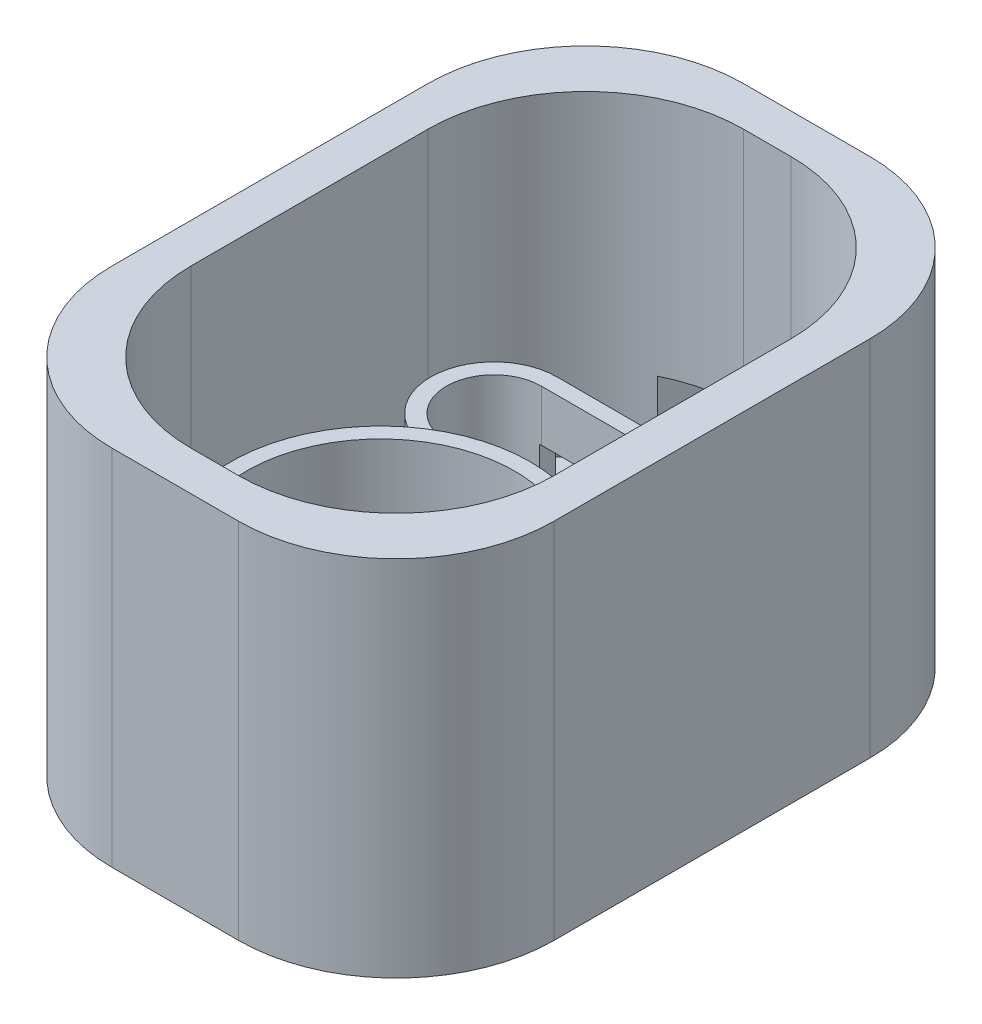
from build123d import *

# Parameters (mm, degrees)
SKETCH1_W               = 28
SKETCH1_H               = 40
SKETCH1_W_2             = 23
SKETCH1_H_2             = 35
BOSS_EXTRUDE4_DEPTH     = 10
SKETCH1_R               = 9.5
SKETCH1_R_2             = 8.5
BOSS_EXTRUDE4_2_DEPTH   = 10
SKETCH1_5_W             = 28
SKETCH1_5_H             = 40
SKETCH1_5_W_2           = 23
SKETCH1_5_H_2           = 35
BOSS_EXTRUDE5_DEPTH     = 20
SKETCH3_W               = 28
SKETCH3_H               = 40
BOSS_EXTRUDE6_DEPTH     = 3
BOSS_EXTRUDE9_DEPTH     = 8
CUT_EXTRUDE2_DEPTH      = 11
CUT_EXTRUDE2_DEPTH_BACK = 8
SKETCH6_W               = 3.5
SKETCH6_H               = 3.5
FILLET1_R               = 10


with BuildPart() as part:
    # Sketch1 → Boss-Extrude4 (new body)
    with BuildSketch(Plane(origin=(0, 0, 0), x_dir=(1, 0, 0), z_dir=(0, 1, 0))):
        with Locations((0, 7)):
            Rectangle(SKETCH1_W, SKETCH1_H)
        with Locations((0, 7)):
            Rectangle(SKETCH1_W_2, SKETCH1_H_2, mode=Mode.SUBTRACT)
    extrude(amount=BOSS_EXTRUDE4_DEPTH)

    # Sketch1<5> → Boss-Extrude5 (add)
    with BuildSketch(Plane(origin=(0, 0, 0), x_dir=(1, 0, 0), z_dir=(0, 1, 0))):
        with Locations((0, 7)):
            Rectangle(SKETCH1_5_W, SKETCH1_5_H)
        with Locations((0, 7)):
            Rectangle(SKETCH1_5_W_2, SKETCH1_5_H_2, mode=Mode.SUBTRACT)
    extrude(amount=BOSS_EXTRUDE5_DEPTH)



with BuildPart() as body_2:
    # Sketch1 → Boss-Extrude4 2 (new body)
    with BuildSketch(Plane(origin=(0, 0, 0), x_dir=(1, 0, 0), z_dir=(0, 1, 0))):
        with Locations(Location((0, 0, 0), (0, 0, 270))):
            Circle(SKETCH1_R)
        with Locations(Location((0, 0, 0), (0, 0, 270))):
            Circle(SKETCH1_R_2, mode=Mode.SUBTRACT)
    extrude(amount=BOSS_EXTRUDE4_2_DEPTH)


with BuildPart() as part_1:
    add(part.part)

    add(body_2.part)  # Boss-Extrude6 merges body 2
    # Sketch3 → Boss-Extrude6 (add)
    with BuildSketch(Plane.XZ):
        with Locations((0, -7)):
            Rectangle(SKETCH3_W, SKETCH3_H)
    extrude(amount=BOSS_EXTRUDE6_DEPTH)


with BuildPart() as body_2_2:
    # Sketch4 → Boss-Extrude9 (new body)
    with BuildSketch(Plane(origin=(0, 0, 0), x_dir=(1, 0, 0), z_dir=(0, 1, 0))):
        with BuildLine():
            Line((-5.815986723, 17), (5.576152219, 17))
            ThreePointArc((5.576152219, 17), (9.576152219, 13), (5.576152219, 9))
            Line((5.576152219, 9), (-5.815986723, 9))
            ThreePointArc((-5.815986723, 9), (-9.815986723, 13), (-5.815986723, 17))
        make_face()
        with BuildLine():
            Line((-5.815986723, 16), (5.576152219, 16))
            ThreePointArc((5.576152219, 16), (8.576152219, 13), (5.576152219, 10))
            Line((5.576152219, 10), (-5.815986723, 10))
            ThreePointArc((-5.815986723, 10), (-8.815986723, 13), (-5.815986723, 16))
        make_face(mode=Mode.SUBTRACT)
    extrude(amount=BOSS_EXTRUDE9_DEPTH)


with BuildPart() as cut_extrude2_tool:
    # Sketch6 → Cut-Extrude2 (new, two sides: drawn at the far end of the back side and taken through both)
    with BuildSketch(Plane.XY.offset(-24.5).offset(-CUT_EXTRUDE2_DEPTH_BACK)):
        with Locations((3.826152219, 3.007864186)):
            Rectangle(SKETCH6_W, SKETCH6_H)
        with Locations((-0.173847781, 3.007864186)):
            Rectangle(SKETCH6_W, SKETCH6_H)
        with Locations((-4.173847781, 3.007864186)):
            Rectangle(SKETCH6_W, SKETCH6_H)
    extrude(amount=CUT_EXTRUDE2_DEPTH + CUT_EXTRUDE2_DEPTH_BACK)


with BuildPart() as part_2:
    add(part_1.part)

    # Cut-Extrude2: cut by cut_extrude2_tool
    add(cut_extrude2_tool.part, mode=Mode.SUBTRACT)

    # Fillet1
    # the kernel refuses this fillet: 10 mm, written as the material it adds along each edge
    with BuildSketch(Plane(origin=(-11.5, 20, 10.5), x_dir=(0, 0, -1), z_dir=(0, -1, 0)), Plane(origin=(11.5, 20, 10.5), x_dir=(-1, 0, 0), z_dir=(0, -1, 0))) as fillet1_piece_1:
        with BuildLine():
            CenterArc((FILLET1_R, FILLET1_R), FILLET1_R, 180, 90)
            Line((0, FILLET1_R), (0, 0))
            Line((0, 0), (FILLET1_R, 0))
        make_face()
    extrude(amount=20)
    with BuildSketch(Plane(origin=(11.5, 20, -24.5), x_dir=(0, 0, 1), z_dir=(0, -1, 0))) as fillet1_piece_2_section:
        with BuildLine():
            CenterArc((FILLET1_R, FILLET1_R), FILLET1_R, 180, 90)
            Line((0, FILLET1_R), (0, 0))
            Line((0, 0), (FILLET1_R, 0))
        make_face()
    fillet1_piece_2 = extrude(amount=45, mode=Mode.PRIVATE)
    fillet1_piece_2 = split(fillet1_piece_2, bisect_by=Plane(origin=(9.534581137, 4.757864186, -22.153586086), z_dir=(0, 1, 0)), keep=Keep.TOP, mode=Mode.PRIVATE)
    add(fillet1_piece_2)
    with BuildSketch(Plane(origin=(11.5, 45, -24.5), x_dir=(0, 0, 1), z_dir=(0, -1, 0))) as fillet1_piece_3_section:
        with BuildLine():
            CenterArc((FILLET1_R, FILLET1_R), FILLET1_R, 180, 90)
            Line((0, FILLET1_R), (0, 0))
            Line((0, 0), (FILLET1_R, 0))
        make_face()
    fillet1_piece_3 = extrude(amount=45, mode=Mode.PRIVATE)
    fillet1_piece_3 = split(fillet1_piece_3, bisect_by=Plane(origin=(9.534581137, 4.757864186, -22.153586086), z_dir=(0, -1, 0)), keep=Keep.TOP, mode=Mode.PRIVATE)
    fillet1_piece_3 = split(fillet1_piece_3, bisect_by=Plane(origin=(5.576152219, 3.007864186, -22.153586086), z_dir=(1, 0, 0)), keep=Keep.TOP, mode=Mode.PRIVATE)
    add(fillet1_piece_3)
    with BuildSketch(Plane(origin=(11.5, 45, -24.5), x_dir=(0, 0, 1), z_dir=(0, -1, 0))) as fillet1_piece_4_section:
        with BuildLine():
            CenterArc((FILLET1_R, FILLET1_R), FILLET1_R, 180, 90)
            Line((0, FILLET1_R), (0, 0))
            Line((0, 0), (FILLET1_R, 0))
        make_face()
    fillet1_piece_4 = extrude(amount=45, mode=Mode.PRIVATE)
    fillet1_piece_4 = split(fillet1_piece_4, bisect_by=Plane(origin=(1.933005634, 4.757864186, -24.495005975), z_dir=(0, -1, 0)), keep=Keep.TOP, mode=Mode.PRIVATE)
    fillet1_piece_4 = split(fillet1_piece_4, bisect_by=Plane(origin=(2.076152219, 3.007864186, -24.495005975), z_dir=(-1, 0, 0)), keep=Keep.TOP, mode=Mode.PRIVATE)
    fillet1_piece_4 = split(fillet1_piece_4, bisect_by=Plane(origin=(1.576152219, 3.007864186, -24.495005975), z_dir=(1, 0, 0)), keep=Keep.TOP, mode=Mode.PRIVATE)
    add(fillet1_piece_4)
    with BuildSketch(Plane(origin=(11.5, 45, -24.5), x_dir=(0, 0, 1), z_dir=(0, -1, 0))) as fillet1_piece_5_section:
        with BuildLine():
            CenterArc((FILLET1_R, FILLET1_R), FILLET1_R, 180, 90)
            Line((0, FILLET1_R), (0, 0))
            Line((0, 0), (FILLET1_R, 0))
        make_face()
    fillet1_piece_5 = extrude(amount=45, mode=Mode.PRIVATE)
    fillet1_piece_5 = split(fillet1_piece_5, bisect_by=Plane(origin=(4.573444491, 1.257864186, -24.240822934), z_dir=(0, -1, 0)), keep=Keep.TOP, mode=Mode.PRIVATE)
    add(fillet1_piece_5)
    with BuildSketch(Plane(origin=(-11.5, 0, -24.5), x_dir=(0, 0, 1), z_dir=(0, 1, 0))) as fillet1_piece_6_section:
        with BuildLine():
            CenterArc((FILLET1_R, FILLET1_R), FILLET1_R, 180, 90)
            Line((0, FILLET1_R), (0, 0))
            Line((0, 0), (FILLET1_R, 0))
        make_face()
    fillet1_piece_6 = extrude(amount=45, mode=Mode.PRIVATE)
    fillet1_piece_6 = split(fillet1_piece_6, bisect_by=Plane(origin=(-9.597009407, 1.257864186, -22.122684576), z_dir=(0, -1, 0)), keep=Keep.TOP, mode=Mode.PRIVATE)
    add(fillet1_piece_6)
    with BuildSketch(Plane(origin=(-11.5, 0, -24.5), x_dir=(0, 0, 1), z_dir=(0, 1, 0))) as fillet1_piece_7_section:
        with BuildLine():
            CenterArc((FILLET1_R, FILLET1_R), FILLET1_R, 180, 90)
            Line((0, FILLET1_R), (0, 0))
            Line((0, 0), (FILLET1_R, 0))
        make_face()
    fillet1_piece_7 = extrude(amount=20, mode=Mode.PRIVATE)
    fillet1_piece_7 = split(fillet1_piece_7, bisect_by=Plane(origin=(-5.923847781, 3.007864186, -22.122684576), z_dir=(-1, 0, 0)), keep=Keep.TOP, mode=Mode.PRIVATE)
    add(fillet1_piece_7)
    with BuildSketch(Plane(origin=(-11.5, 0, -24.5), x_dir=(0, 0, 1), z_dir=(0, 1, 0))) as fillet1_piece_8_section:
        with BuildLine():
            CenterArc((FILLET1_R, FILLET1_R), FILLET1_R, 180, 90)
            Line((0, FILLET1_R), (0, 0))
            Line((0, 0), (FILLET1_R, 0))
        make_face()
    fillet1_piece_8 = extrude(amount=20, mode=Mode.PRIVATE)
    fillet1_piece_8 = split(fillet1_piece_8, bisect_by=Plane(origin=(-2.423847781, 3.007864186, -24.486093352), z_dir=(1, 0, 0)), keep=Keep.TOP, mode=Mode.PRIVATE)
    fillet1_piece_8 = split(fillet1_piece_8, bisect_by=Plane(origin=(-1.923847781, 3.007864186, -24.486093352), z_dir=(-1, 0, 0)), keep=Keep.TOP, mode=Mode.PRIVATE)
    add(fillet1_piece_8)
    with BuildSketch(Plane(origin=(-11.5, -25, -24.5), x_dir=(0, 0, 1), z_dir=(0, 1, 0))) as fillet1_piece_9_section:
        with BuildLine():
            CenterArc((FILLET1_R, FILLET1_R), FILLET1_R, 180, 90)
            Line((0, FILLET1_R), (0, 0))
            Line((0, 0), (FILLET1_R, 0))
        make_face()
    fillet1_piece_9 = extrude(amount=45, mode=Mode.PRIVATE)
    fillet1_piece_9 = split(fillet1_piece_9, bisect_by=Plane(origin=(-4.853134355, 4.757864186, -24.190800043), z_dir=(0, 1, 0)), keep=Keep.TOP, mode=Mode.PRIVATE)
    add(fillet1_piece_9)
    # the kernel refuses this fillet: 10 mm, written as the material it takes off along each edge
    with BuildSketch(Plane(origin=(-14, 45, -27), x_dir=(0, 0, 1), z_dir=(0, -1, 0)), Plane(origin=(14, -28, 13), x_dir=(-1, 0, 0), z_dir=(0, 1, 0)), Plane(origin=(-14, -28, 13), x_dir=(0, 0, -1), z_dir=(0, 1, 0))) as fillet1_2_piece_1:
        with BuildLine():
            CenterArc((FILLET1_R, -FILLET1_R), FILLET1_R, 90, 90)
            Line((0, -FILLET1_R), (0, 0))
            Line((0, 0), (FILLET1_R, 0))
        make_face()
    extrude(amount=73, mode=Mode.SUBTRACT)
    with BuildSketch(Plane(origin=(14, 45, -27), x_dir=(0, 0, 1), z_dir=(0, -1, 0))) as fillet1_2_piece_2:
        with BuildLine():
            CenterArc((FILLET1_R, FILLET1_R), FILLET1_R, 180, 90)
            Line((0, FILLET1_R), (0, 0))
            Line((0, 0), (FILLET1_R, 0))
        make_face()
    extrude(amount=73, mode=Mode.SUBTRACT)


with BuildPart() as body_2_2_1:
    add(body_2_2.part)

    # Cut-Extrude2: cut by cut_extrude2_tool
    add(cut_extrude2_tool.part, mode=Mode.SUBTRACT)


solid = Compound([part_2.part, body_2_2_1.part])
